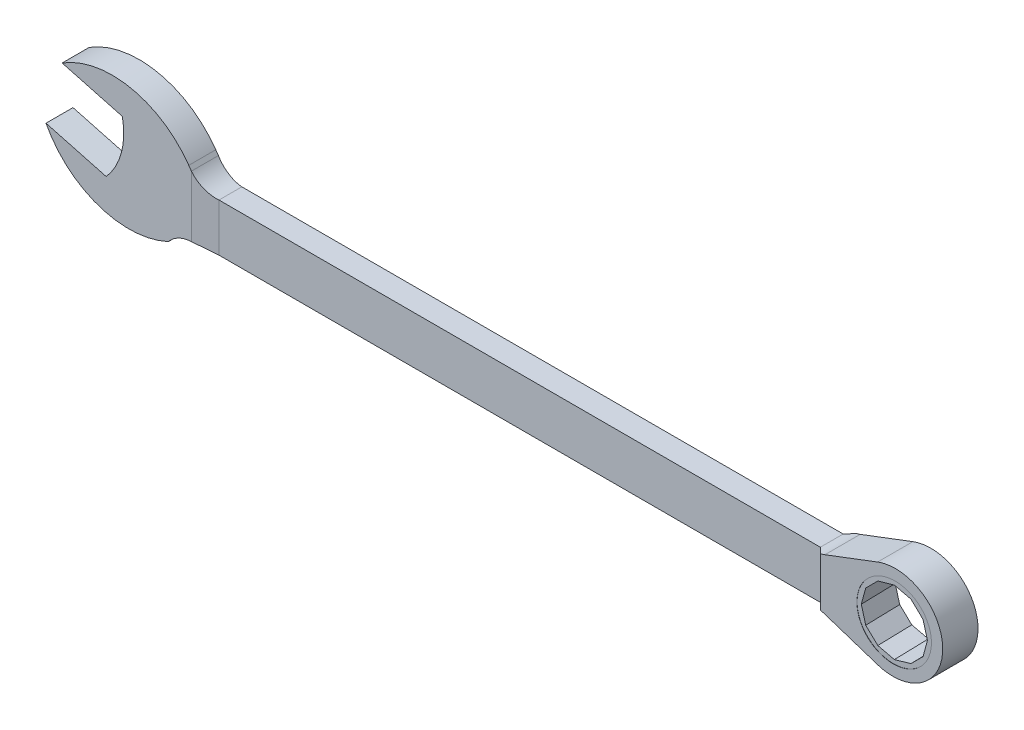
from build123d import *

# Parameters (mm, degrees)
AUFSATZ_LINEAR_AUSTRAGEN2_DEPTH      = 20
VERRUNDUNG1_R                        = 15
SCHNITT_LINEAR_AUSTRAGEN3_DEPTH      = 229.701880893
SCHNITT_LINEAR_AUSTRAGEN3_DEPTH_BACK = 229.701880893
SKIZZE5_OUTSIDE_W                    = 521.679
SKIZZE5_OUTSIDE_H                    = 109.418
SCHNITT_LINEAR_AUSTRAGEN6_DEPTH      = 228.676613663
SKIZZE7_R                            = 17.5
SCHNITT_LINEAR_AUSTRAGEN5_DEPTH      = 0.1
SCHNITT_LINEAR_START                 = -0.1
SKIZZE9_R                            = 17.5
SCHNITT_LINEAR_AUSTRAGEN7_DEPTH      = 0.1
VERRUNDUNG5_R                        = 15


with BuildPart() as part:
    # Skizze1 → Aufsatz-Linear austragen2 (new body)
    with BuildSketch(Plane.XY):
        with BuildLine():
            Line((-216.718948666, 31.869537692), (-187.741173877, 24.104966339))
            ThreePointArc((-187.741173877, 24.104966339), (-188.20309721, 8.699595617), (-195.50574523, -4.87280845))
            Line((-195.50574523, -4.87280845), (-224.483520019, 2.891762903))
            ThreePointArc((-224.483520019, 2.891762903), (-199.032056143, -18.892233896), (-165.581524585, -17.053356943))
            Line((-165.581524585, -17.053356943), (-161.471528727, -11.5))
            Line((-161.471528727, -11.5), (150, -11.5))
            Line((150, -11.5), (177.209748999, -21.403538717))
            ThreePointArc((177.209748999, -21.403538717), (207.777170155, 0), (177.209748999, 21.403538717))
            Line((177.209748999, 21.403538717), (150, 11.5))
            Line((150, 11.5), (-150, 11.5))
            Line((-150, 11.5), (-155.735764364, 19.691520443))
            ThreePointArc((-155.735764364, 19.691520443), (-183.785335986, 38.009300378), (-216.718948666, 31.869537692))
        make_face()
    extrude(amount=AUFSATZ_LINEAR_AUSTRAGEN2_DEPTH)

    # Verrundung1
    verrundung1_edges = [part.edges().sort_by_distance(p)[0] for p in [
        (-150, 11.5, 10),
        (150, 11.5, 10),
        (150, -11.5, 10),
    ]]
    fillet(verrundung1_edges, radius=VERRUNDUNG1_R)

    # Skizze5 outside → Schnitt-Linear austragen3 (cut, two sides: drawn at the far end of the back side and taken through both)
    with BuildSketch(Plane(origin=(0, 0, 0), x_dir=(1, 0, 0), z_dir=(0, 1, 0)).offset(-SCHNITT_LINEAR_AUSTRAGEN3_DEPTH_BACK)):
        with Locations((-8.3535, -10)):
            Rectangle(SKIZZE5_OUTSIDE_W, SKIZZE5_OUTSIDE_H)
        Polygon((147.355095289, -15.5), (150.355095289, -18.5), (207.777170155, -17), (207.777170155, 0), (150.355095289, -1.5), (147.355095289, -4.5), (-142.191494242, -4.5), (-154.478774906, -3.5), (-224.483520019, -3.5), (-224.483520019, -16.5), (-154.478774906, -16.5), (-142.191494242, -15.5), align=None, mode=Mode.SUBTRACT)
    extrude(amount=SCHNITT_LINEAR_AUSTRAGEN3_DEPTH + SCHNITT_LINEAR_AUSTRAGEN3_DEPTH_BACK, mode=Mode.SUBTRACT)

    # Skizze8 → Schnitt-Linear austragen6 (cut, through all)
    with BuildSketch(Plane(origin=(-1.278585019, 0, 22.46102929), x_dir=(0.9996589857202393, 0, -0.026113449959408383), z_dir=(0.026113449959408383, 0, 0.9996589857202393))):
        Polygon((201.871273052, 0), (199.790762428, 7.764571353), (194.106701699, 13.448632083), (186.342130346, 15.529142706), (178.577558993, 13.448632083), (172.893498263, 7.764571353), (170.81298764, 0), (172.893498263, -7.764571353), (178.577558993, -13.448632083), (186.342130346, -15.529142706), (194.106701699, -13.448632083), (199.790762428, -7.764571353), align=None)
    extrude(amount=-SCHNITT_LINEAR_AUSTRAGEN6_DEPTH, mode=Mode.SUBTRACT)

    # Skizze7 → Schnitt-Linear austragen5 (cut)
    with BuildSketch(Plane(origin=(-0.373956847, 0, 5.437398269), x_dir=(-0.9996589857202394, 0, 0.026113449959408383), z_dir=(-0.026113449959408383, 0, -0.9996589857202394))):
        with Locations((-184.993264929, 0)):
            Circle(SKIZZE7_R)
    extrude(amount=-SCHNITT_LINEAR_AUSTRAGEN5_DEPTH, mode=Mode.SUBTRACT)

    # Skizze9 → Schnitt-Linear austragen7 (cut)
    with BuildSketch(Plane(origin=(0.585463065, 0, 22.412335959), x_dir=(0.9996589857202393, 0, -0.026113449959408383), z_dir=(0.026113449959408383, 0, 0.9996589857202393)).offset(SCHNITT_LINEAR_START)):
        with Locations(Location((184.477446379, 0, 0), (0, 0, 180))):
            Circle(SKIZZE9_R)
    extrude(amount=SCHNITT_LINEAR_AUSTRAGEN7_DEPTH, mode=Mode.SUBTRACT)

    # Verrundung5
    # the kernel refuses this fillet: 15 mm, written as the material it adds along each edge
    with BuildSketch(Plane(origin=(-161.471528727, -11.5, 3.5), x_dir=(1, 0, 0), z_dir=(0, 0, 1))) as verrundung5_piece_1_section:
        with BuildLine():
            CenterArc((7.541653594, -15), VERRUNDUNG5_R, 90, 50.96638681)
            Line((-4.109995858, -5.553356943), (-4.343028847, -5.364424082))
            ThreePointArc((-4.343028847, -5.364424082), (-2.296139873, -2.598211212), (-0.241141944, 0.178467259))
            Line((-0.241141944, 0.178467259), (0, 0.3))
            Line((0, 0.3), (7.541653594, 0.3))
            Line((7.541653594, 0.3), (7.541653594, 0))
        make_face()
    verrundung5_piece_1 = extrude(amount=13, mode=Mode.PRIVATE)
    verrundung5_piece_1 = split(verrundung5_piece_1, bisect_by=Plane(origin=(-154.879802837, -11.415872576, 16.532637647), z_dir=(-0.08111677690648599, 0, -0.9967046044361908)), keep=Keep.TOP, mode=Mode.PRIVATE)
    verrundung5_piece_1 = split(verrundung5_piece_1, bisect_by=Plane(origin=(-154.879802837, -11.415872576, 3.467362353), z_dir=(-0.08111677690648603, 0, 0.9967046044361908)), keep=Keep.TOP, mode=Mode.PRIVATE)
    add(verrundung5_piece_1)


solid = part.part
